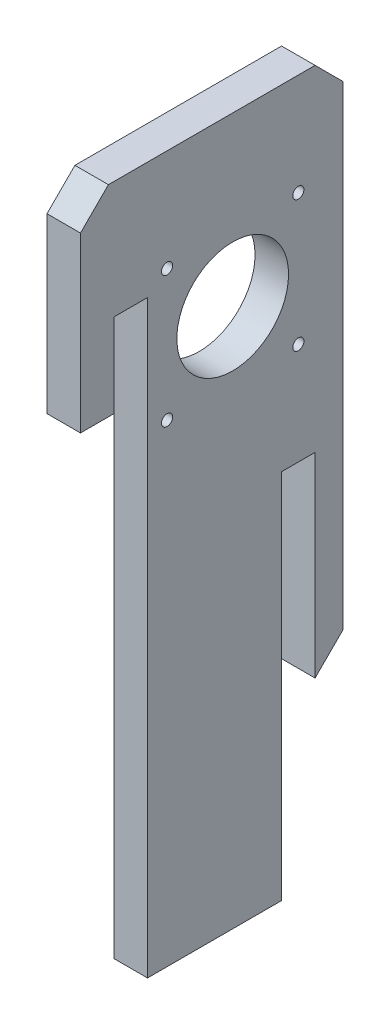
from build123d import *

# Parameters (mm, degrees)
SKETCH1_W                = 59
SKETCH1_H                = 120
SKETCH1_R                = 20
BOSS_EXTRUDE1_DEPTH      = 12
F_4_0_4_DIAMETER_HOLE1_D = 4
HOLE1_D                  = 12
HOLE1_DEPTH              = 6
BOSS_EXTRUDE2_DEPTH      = 12
SKETCH9_W                = 48
SKETCH9_H                = 133
BOSS_EXTRUDE3_DEPTH      = 12
SKETCH11_W               = 10
SKETCH11_H               = 190
BOSS_EXTRUDE4_DEPTH      = 12
CHAMFER1_SIZE            = 10
CHAMFER2_SIZE            = 10


with BuildPart() as part:
    # Sketch1 → Boss-Extrude1 (new body)
    with BuildSketch(Plane(origin=(0, 0, 0), x_dir=(0, 0, -1), z_dir=(1, 0, 0))):
        Rectangle(SKETCH1_W, SKETCH1_H)
        Circle(SKETCH1_R, mode=Mode.SUBTRACT)
    extrude(amount=BOSS_EXTRUDE1_DEPTH)

    # Ø4.0 (4) Diameter Hole1 (through all)
    with Locations(Plane.ZY):
        with Locations((-23.5, 23.5), (23.5, 23.5), (23.5, -23.5), (-23.5, -23.5)):
            Hole(F_4_0_4_DIAMETER_HOLE1_D / 2)

    # Hole1
    with Locations(Plane.ZY):
        with Locations((0, 45), (0, -45)):
            Hole(HOLE1_D / 2, depth=HOLE1_DEPTH)

    # Sketch8 → Boss-Extrude2 (add)
    with BuildSketch(Plane.ZY):
        Polygon((29.5, 60), (29.5, -60), (30.5, -60), (30.5, 18), (42.5, 18), (42.5, -12), (54.5, -12), (54.5, 60), align=None)
    extrude(amount=-BOSS_EXTRUDE2_DEPTH)

    # Sketch9 → Boss-Extrude3 (add)
    with BuildSketch(Plane.ZY):
        with Locations((6.5, -126.5)):
            Rectangle(SKETCH9_W, SKETCH9_H)
    extrude(amount=-BOSS_EXTRUDE3_DEPTH)

    # Sketch11 → Boss-Extrude4 (add)
    with BuildSketch(Plane(origin=(12, 0, 0), x_dir=(0, 0, -1), z_dir=(1, 0, 0))):
        with Locations((34.5, -35)):
            Rectangle(SKETCH11_W, SKETCH11_H)
    extrude(amount=-BOSS_EXTRUDE4_DEPTH)

    # Chamfer1
    chamfer1_edges = [part.edges().sort_by_distance(p)[0] for p in [
        (6, 60, 54.5),
        (6, 60, -39.5),
    ]]
    chamfer(chamfer1_edges, length=CHAMFER1_SIZE)

    # Chamfer2
    chamfer2_edges = [part.edges().sort_by_distance(p)[0] for p in [
        (6, -130, -39.5),
    ]]
    chamfer(chamfer2_edges, length=CHAMFER2_SIZE - 0.0001)  # a hair under: the kernel refuses the full size


solid = part.part
